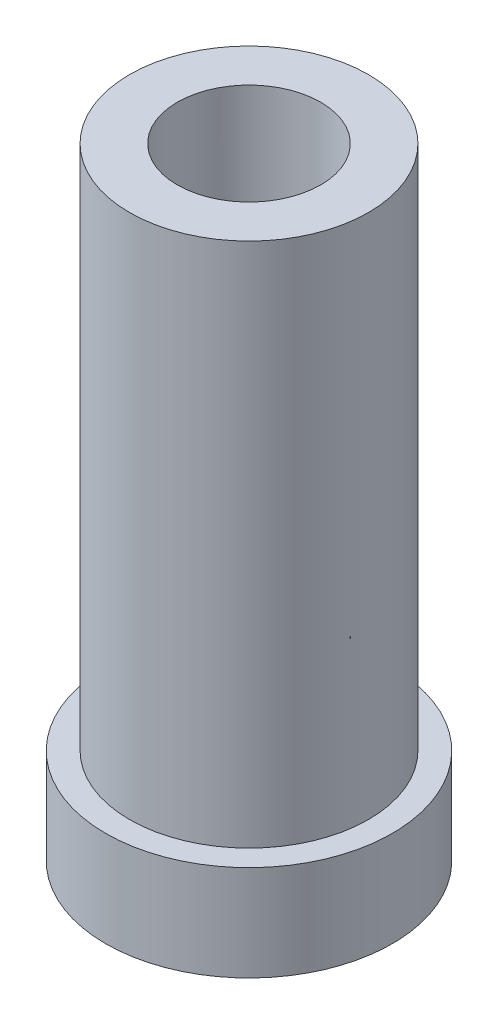
from build123d import *

# Parameters (mm, degrees)
SKETCH1_R           = 2.5
SKETCH1_R_2         = 1.5
BOSS_EXTRUDE1_DEPTH = 11
SKETCH2_R           = 3
BOSS_EXTRUDE2_DEPTH = 2
SKETCH3_R           = 1.5
CUT_EXTRUDE1_DEPTH  = 14.674794331


with BuildPart() as part:
    # Sketch1 → Boss-Extrude1 (new body)
    with BuildSketch(Plane(origin=(0, 0, 0), x_dir=(1, 0, 0), z_dir=(0, 1, 0))):
        Circle(SKETCH1_R)
        Circle(SKETCH1_R_2, mode=Mode.SUBTRACT)
    extrude(amount=BOSS_EXTRUDE1_DEPTH)

    # Sketch2 → Boss-Extrude2 (add)
    with BuildSketch(Plane(origin=(0, 0, 0), x_dir=(-1, 0, 0), z_dir=(0, -1, 0))):
        Circle(SKETCH2_R)
    extrude(amount=BOSS_EXTRUDE2_DEPTH)

    # Sketch3 → Cut-Extrude1 (cut, through all)
    with BuildSketch(Plane(origin=(0, -2, 0), x_dir=(-1, 0, 0), z_dir=(0, -1, 0))):
        Circle(SKETCH3_R)
    extrude(amount=-CUT_EXTRUDE1_DEPTH, mode=Mode.SUBTRACT)


solid = part.part
